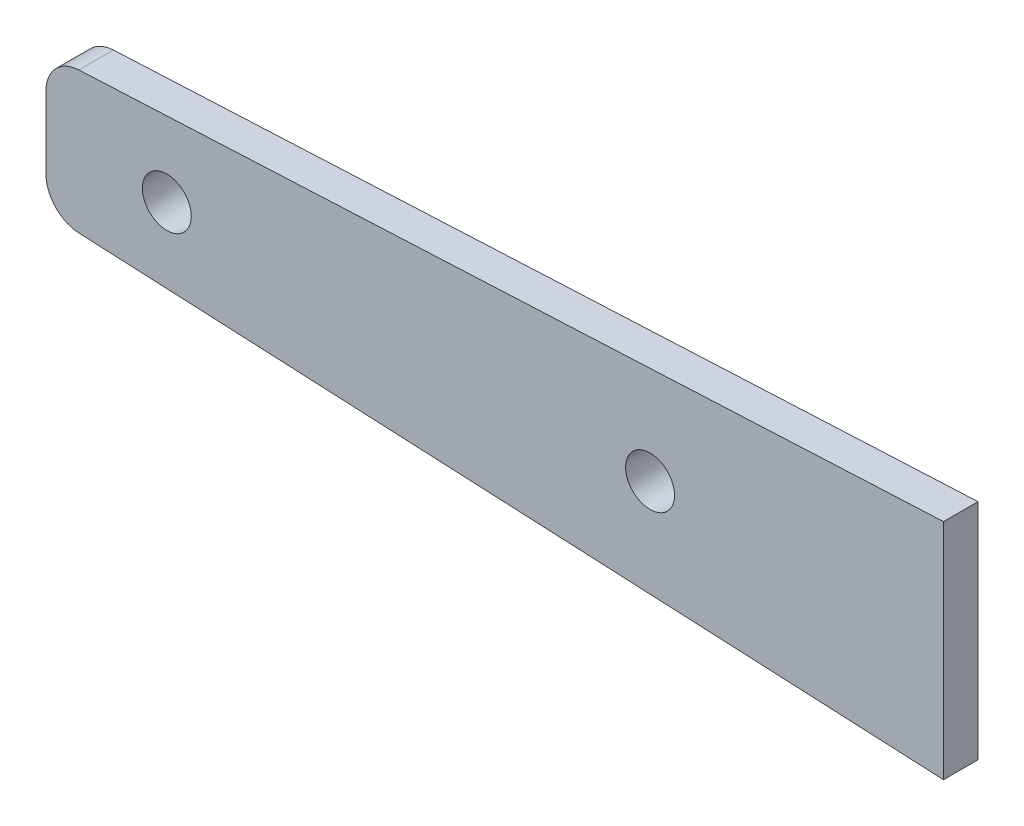
from build123d import *

# Parameters (mm, degrees)
BOSS_EXTRUDE1_DEPTH  = 3.175
M4_CLEARANCE_HOLE2_D = 4.5
FILLET1_R            = 3.175


with BuildPart() as part:
    # Sketch1 → Boss-Extrude1 (new body)
    with BuildSketch(Plane.XY):
        Polygon((33.3375, 9.525), (-33.3375, 6.35), (-33.3375, -6.35), (33.3375, -9.525), (49.2125, -10.280952381), (49.2125, 10.280952381), align=None)
    extrude(amount=BOSS_EXTRUDE1_DEPTH)

    # M4 Clearance Hole2 (through all)
    with Locations(Plane.XY.offset(3.175)):
        with Locations((-22.225, 0), (22.225, 0)):
            Hole(M4_CLEARANCE_HOLE2_D / 2)

    # Fillet1
    fillet1_edges = [part.edges().sort_by_distance(p)[0] for p in [
        (-33.3375, -6.35, 1.5875),
        (-33.3375, 6.35, 1.5875),
    ]]
    fillet(fillet1_edges, radius=FILLET1_R)


solid = part.part
